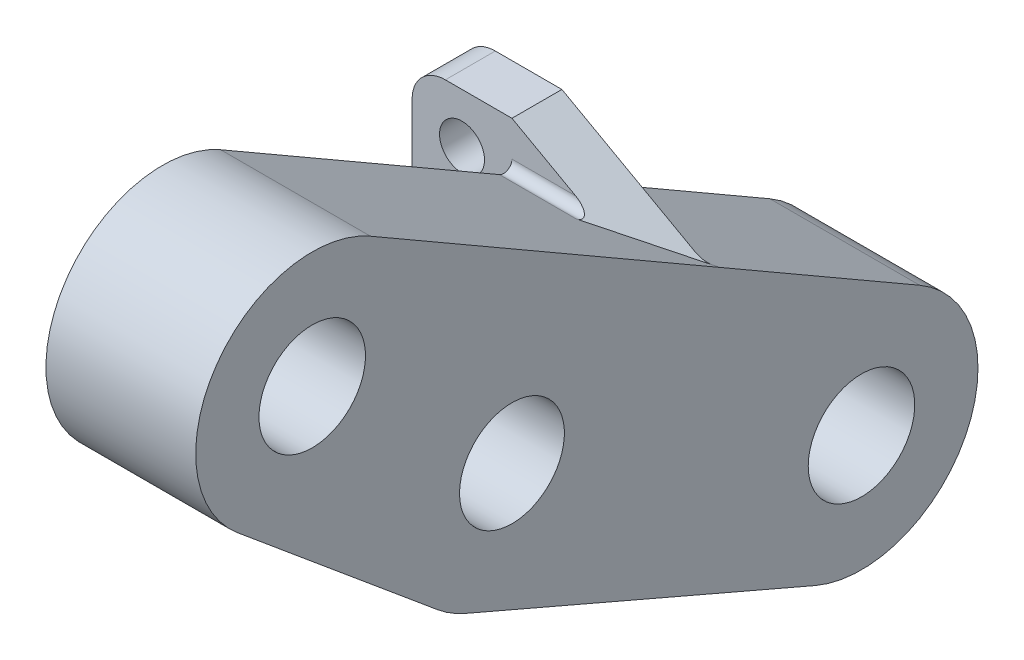
from build123d import *

# Parameters (mm, degrees)
SKETCH1_R                       = 3.20000000000001
SKETCH1_R_2                     = 3.2000000000000157
SKETCH1_R_3                     = 3.1500000000000266
BOSS_EXTRUDE1_DEPTH             = 9.000000000000002
BOSS_EXTRUDE2_DEPTH             = 6
BOSS_EXTRUDE2_DIRECTION_2_REACH = 245.63
SKETCH3_R                       = 1.3499999999999934
CUT_EXTRUDE1_DEPTH              = 243.3192700509415
CHAMFER1_SIZE                   = 6
CHAMFER1_SIZE_2                 = 10
CHAMFER2_SIZE                   = 5
CHAMFER2_SIZE_2                 = 9
FILLET1_R                       = 2
FILLET2_R                       = 0.5
FILLET3_R                       = 0.5
FILLET4_R                       = 1


with BuildPart() as part:
    # Sketch1 → Boss-Extrude1 (new body)
    with BuildSketch(Plane(origin=(9.000000000000002, 0, 0), x_dir=(0, 0, -1), z_dir=(1, 0, 0))):
        with BuildLine():
            Line((3.5235214674406836, 220.17063085897752), (-29.477274377996263, 239.2218112310119))
            ThreePointArc((-29.477274377996263, 239.2218112310119), (-38.718007493319135, 237.16461837930046), (-37.45821987569468, 227.78186152983258))
            Line((-37.45821987569468, 227.78186152983258), (-25.4578021395881, 217.78186152983255))
            ThreePointArc((-25.4578021395881, 217.78186152983255), (-24.640376533153265, 217.19486094146168), (-23.74722639538112, 216.731139964795))
            Line((-23.74722639538112, 216.731139964795), (-2.7468482860507106, 207.6799595927607))
            ThreePointArc((-2.7468482860507106, 207.6799595927607), (6.279741658038257, 210.96778498862912), (3.5235214674406836, 220.17063085897752))
        make_face()
        with Locations(Location((0.02377470320349104, 214.10830683380283, 0), (0, 0, 180))):
            Circle(SKETCH1_R, mode=Mode.SUBTRACT)
        with Locations(Location((-32.97702114223346, 233.1594872058372, 0), (0, 0, 180))):
            Circle(SKETCH1_R_2, mode=Mode.SUBTRACT)
        with Locations(Location((-20.97660340612688, 223.1594872058372, 0), (0, 0, 180))):
            Circle(SKETCH1_R_3, mode=Mode.SUBTRACT)
    extrude(amount=-BOSS_EXTRUDE1_DEPTH)

    # Sketch2 → Boss-Extrude2 (add)
    with BuildSketch(Plane.ZY):
        Polygon((8.976225296796509, 232.10830683380286), (11.976225296796507, 232.10830683380286), (11.97622529679651, 211.6578287344907), (8.976225296796512, 210.36482624783363), align=None)
    extrude(amount=BOSS_EXTRUDE2_DEPTH)

    # Boss-Extrude2 direction 2: up to this face of the body (flat: up to its plane)
    boss_extrude2_direction_2_end = Plane(part.part.faces().sort_by_distance((9, 223.146004551, 16.682900482))[0])
    # Sketch2 → Boss-Extrude2 direction 2 (add, up to the picked face)
    with BuildSketch(Plane.ZY, mode=Mode.PRIVATE) as boss_extrude2_direction_2_sk1:
        Polygon((8.976225296796509, 232.10830683380286), (11.976225296796507, 232.10830683380286), (11.97622529679651, 211.6578287344907), (8.976225296796512, 210.36482624783363), align=None)
    boss_extrude2_direction_2_tool1 = split(extrude(boss_extrude2_direction_2_sk1.sketch, amount=-BOSS_EXTRUDE2_DIRECTION_2_REACH, mode=Mode.PRIVATE), bisect_by=boss_extrude2_direction_2_end, keep=Keep.BOTH, mode=Mode.PRIVATE)
    add(boss_extrude2_direction_2_tool1.solids().sort_by(Axis((0, 221.556515, 10.460903), (1, 0, 0)))[0])

    # Sketch3 → Cut-Extrude1 (cut, through all)
    with BuildSketch(Plane(origin=(0, 1.43e-15, 8.976225296796544), x_dir=(-1, 0, 0), z_dir=(0, -1.6e-16, -1))):
        with Locations(Location((3, 229.10830683380286, 0), (0, 0, 90))):
            Circle(SKETCH3_R)
    extrude(amount=-CUT_EXTRUDE1_DEPTH, mode=Mode.SUBTRACT)

    # Chamfer1
    # the kernel refuses this chamfer: 10, 6 mm, written as the material it takes off along each edge
    with BuildSketch(Plane(origin=(-6, 221.89433509463086, 35.72677442359438), x_dir=(0.9984760801092615, -0.05067944312803606, 0.021842881995648558), z_dir=(0, -0.3958032841791771, -0.9183353201488973))) as chamfer1_piece_1:
        Polygon((CHAMFER1_SIZE * 0.998476080109, -CHAMFER1_SIZE * 0.0551862070598), (-CHAMFER1_SIZE_2 * 0.0551862070598, -CHAMFER1_SIZE_2 * 0.998476080109), (0, 0), align=None)
    extrude(amount=54.99200253498646, mode=Mode.SUBTRACT)

    # Chamfer2
    # the kernel refuses this chamfer: 9, 5 mm, written as the material it takes off along each edge
    with BuildSketch(Plane(origin=(9.000000000000002, 232.10830683380286, -14.314617746831651), x_dir=(0.060700782983652134, -0.9981560073180803, 0), z_dir=(0, 0, 1))) as chamfer2_piece_1_section:
        Polygon((CHAMFER2_SIZE * 0.998156007318, -CHAMFER2_SIZE * 0.0607007829837), (-CHAMFER2_SIZE_2 * 0.0607007829837, -CHAMFER2_SIZE_2 * 0.998156007318), (0, 0), align=None)
    chamfer2_piece_1 = extrude(amount=49.581686087256315, mode=Mode.PRIVATE)
    chamfer2_piece_1 = split(chamfer2_piece_1, bisect_by=Plane(origin=(5.860742966777749, 228.82016054729928, 11.45934877100172), z_dir=(0, 0.8660462893106784, -0.49996382346246293)), keep=Keep.TOP, mode=Mode.PRIVATE)
    add(chamfer2_piece_1, mode=Mode.SUBTRACT)

    # Fillet1
    fillet1_edges = [part.edges().sort_by_distance(p)[0] for p in [
        (-6, 232.10830683380286, 10.476225296796507),
    ]]
    fillet(fillet1_edges, radius=FILLET1_R)

    # Fillet2
    fillet2_edges = [part.edges().sort_by_distance(p)[0] for p in [
        (4.249475994772133, 227.38666683961173, 8.97622529679651),
    ]]
    fillet(fillet2_edges, radius=FILLET2_R)

    # Fillet3
    fillet3_edges = [part.edges().sort_by_distance(p)[0] for p in [
        (2.6907806455631165, 229.11855056095553, 11.976225296796507),
    ]]
    fillet(fillet3_edges, radius=FILLET3_R)

    # Fillet4
    fillet4_edges = [part.edges().sort_by_distance(p)[0] for p in [
        (0, 219.020091073198, 8.97622529679651),
    ]]
    fillet(fillet4_edges, radius=FILLET4_R)


solid = part.part
